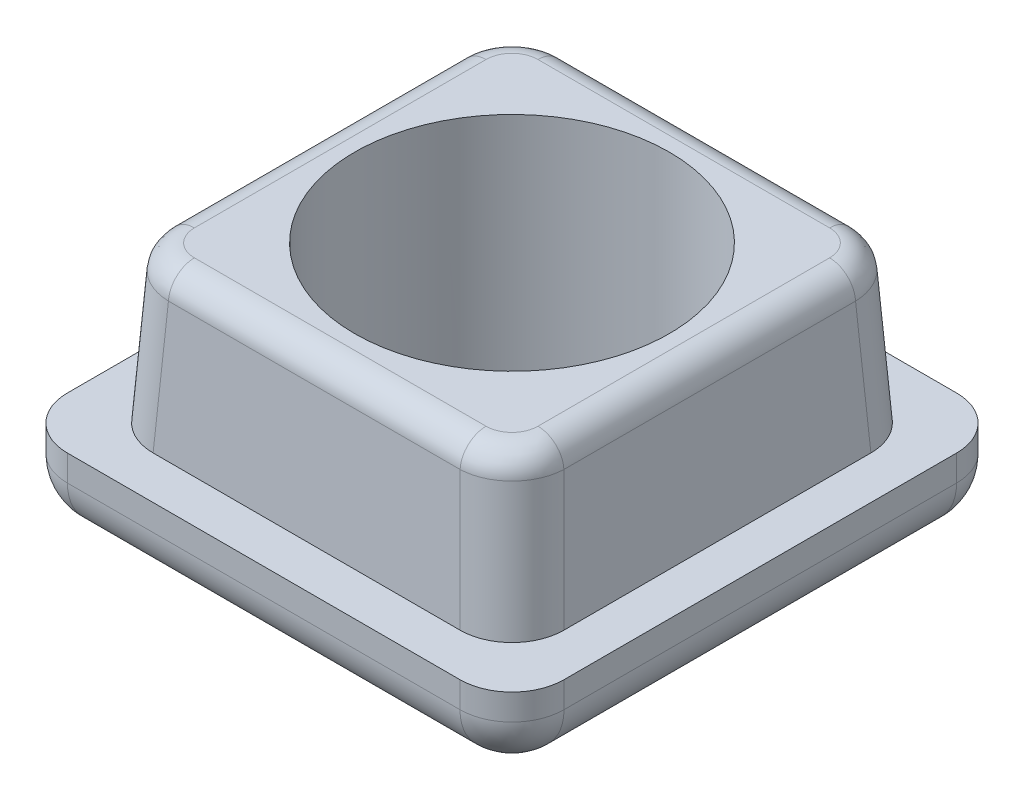
from build123d import *

# Parameters (mm, degrees)
SKETCH1_W           = 19.1
SKETCH1_H           = 19.1
BOSS_EXTRUDE1_DEPTH = 3
SKETCH4_R           = 6.05
CUT_EXTRUDE1_DEPTH  = 29.471389179
FILLET1_R           = 2
FILLET2_R           = 1
FILLET3_R           = 2


with BuildPart() as part:
    # Sketch1 → Boss-Extrude1 (new body)
    with BuildSketch(Plane(origin=(0, 0, 0), x_dir=(1, 0, 0), z_dir=(0, 1, 0))):
        with Locations((9.55, 9.55)):
            Rectangle(SKETCH1_W, SKETCH1_H)
    extrude(amount=BOSS_EXTRUDE1_DEPTH)

    # Sketch2 → Loft1 section 0
    with BuildSketch(Plane(origin=(0, 3, 0), x_dir=(1, 0, 0), z_dir=(0, 1, 0))):
        with BuildLine():
            Line((1.65, 1.65), (17.45, 1.65))
            Line((17.45, 1.65), (17.45, 17.45))
            Line((17.45, 17.45), (1.65, 17.45))
            Line((1.65, 17.45), (1.65, 1.65))
        make_face()
    # Sketch3 → Loft1 section 1
    with BuildSketch(Plane(origin=(0, 9, 0), x_dir=(1, 0, 0), z_dir=(0, 1, 0))):
        with BuildLine():
            Line((2, 2), (17.1, 2))
            Line((17.1, 2), (17.1, 17.1))
            Line((17.1, 17.1), (2, 17.1))
            Line((2, 17.1), (2, 2))
        make_face()
    loft()

    # Sketch4 → Cut-Extrude1 (cut, through all)
    with BuildSketch(Plane.XZ):
        with Locations((9.55, -9.55)):
            Circle(SKETCH4_R)
    extrude(amount=-CUT_EXTRUDE1_DEPTH, mode=Mode.SUBTRACT)

    # Fillet1
    fillet1_edges = [part.edges().sort_by_distance(p)[0] for p in [
        (17.275, 6, -1.825),
        (17.275, 6, -17.275),
        (1.825, 6, -17.275),
        (1.825, 6, -1.825),
        (19.1, 1.5, 0),
        (0, 1.5, 0),
        (19.1, 1.5, -19.1),
        (0, 1.5, -19.1),
    ]]
    fillet(fillet1_edges, radius=FILLET1_R)

    # Fillet2
    fillet2_edges = [part.edges().sort_by_distance(p)[0] for p in [
        (2.584382231, 9, -16.515617769),
        (9.55, 9, -17.1),
        (16.515617769, 9, -16.515617769),
        (17.1, 9, -9.55),
        (16.515617769, 9, -2.584382231),
        (9.55, 9, -2),
        (2.584382231, 9, -2.584382231),
        (2, 9, -9.55),
    ]]
    fillet(fillet2_edges, radius=FILLET2_R)

    # Fillet3
    fillet3_edges = [part.edges().sort_by_distance(p)[0] for p in [
        (0.585786438, 0, -0.585786438),
        (0, 0, -9.55),
        (0.585786438, 0, -18.514213562),
        (9.55, 0, -19.1),
        (18.514213562, 0, -18.514213562),
        (19.1, 0, -9.55),
        (18.514213562, 0, -0.585786438),
        (9.55, 0, 0),
    ]]
    fillet(fillet3_edges, radius=FILLET3_R)


solid = part.part
